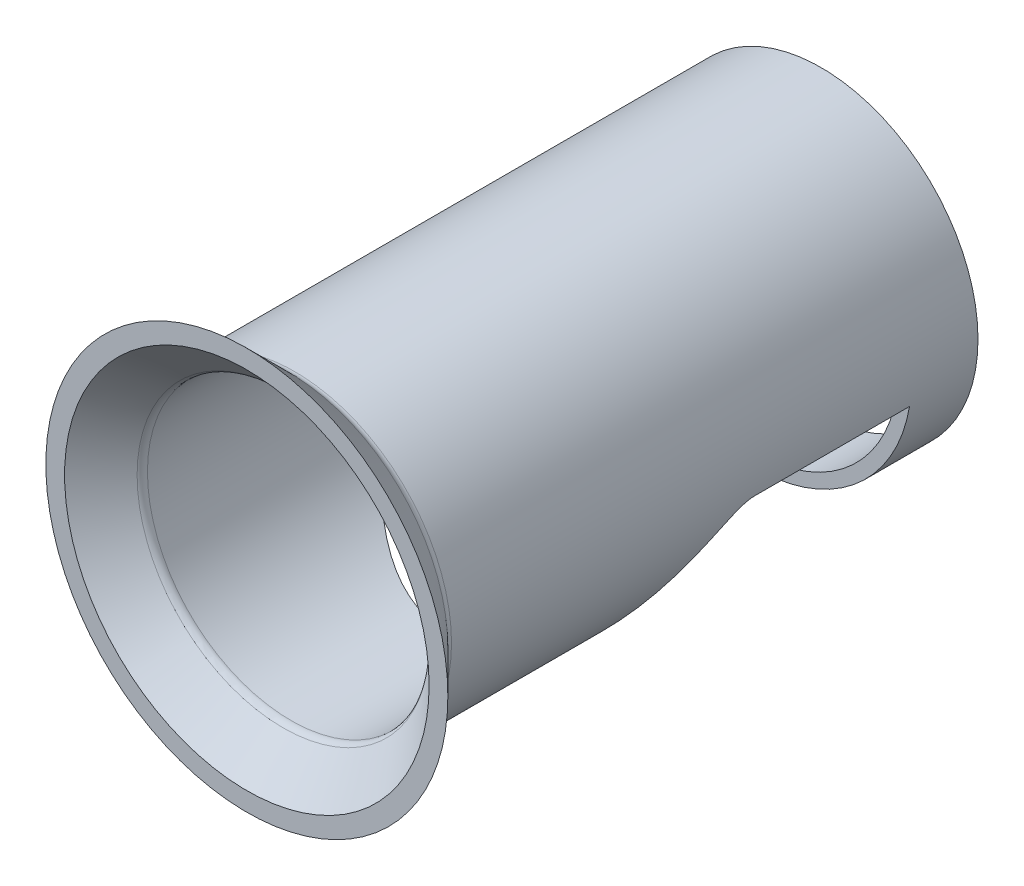
from build123d import *

# Parameters (mm, degrees)
SCHIZZO1_R                   = 17.75
SCHIZZO1_R_2                 = 16.25
ESTRUSIONE_ESTRUSIONE1_DEPTH = 170
TAGLIO_ESTRUSIONE1_DEPTH     = 170
TAGLIO_ESTRUSIONE2_START     = -60
SCHIZZO4_R                   = 41.734641341
TAGLIO_ESTRUSIONE2_DEPTH     = 112.843315381
SCHIZZO5_R                   = 17.75
SCHIZZO6_R                   = 22.75
RACCORDO1_R                  = 1


with BuildPart() as part:
    # Schizzo1 → Estrusione-Estrusione1 (new body)
    with BuildSketch(Plane.XY):
        Circle(SCHIZZO1_R)
        Circle(SCHIZZO1_R_2, mode=Mode.SUBTRACT)
    extrude(amount=ESTRUSIONE_ESTRUSIONE1_DEPTH)

    # Schizzo2 → Taglio-Estrusione1 (cut)
    with BuildSketch(Plane(origin=(0, 0, 0), x_dir=(1, 0, 0), z_dir=(0, 1, 0))):
        with BuildLine():
            Line((-17.5, -25), (-17.5, -7.5))
            Line((-17.5, -7.5), (17.5, -7.5))
            Line((17.5, -7.5), (17.5, -25))
            ThreePointArc((17.5, -25), (0, -42.5), (-17.5, -25))
        make_face()
    extrude(amount=-TAGLIO_ESTRUSIONE1_DEPTH, mode=Mode.SUBTRACT)

    # Schizzo4 → Taglio-Estrusione2 (cut, through all)
    with BuildSketch(Plane(origin=(0, 0, 0), x_dir=(-1, 0, 0), z_dir=(0, 0, -1)).offset(TAGLIO_ESTRUSIONE2_START)):
        Circle(SCHIZZO4_R)
    extrude(amount=-TAGLIO_ESTRUSIONE2_DEPTH, mode=Mode.SUBTRACT)

    # Schizzo5 → Loft2 section 0
    with BuildSketch(Plane.XY.offset(60)):
        Circle(SCHIZZO5_R)
    # Schizzo6 → Loft2 section 1
    with BuildSketch(Plane.XY.offset(65)):
        Circle(SCHIZZO6_R)
    loft()

    # Schizzo9 → Taglia-Rivoluzione1 (revolve, cut)
    with BuildSketch(Plane(origin=(0, 0, 0), x_dir=(1, 0, 0), z_dir=(0, 1, 0)), mode=Mode.PRIVATE) as taglia_rivoluzione1_sk:
        Polygon((0, -53.809990156), (0, -67.47386211), (23.102541766, -67.47386211), (9.438669813, -53.809990156), align=None)
    revolve(taglia_rivoluzione1_sk.sketch.rotate(Axis((0, 0, 53.809990156), (0, 0, 1)), 180), axis=Axis((0, 0, 53.809990156), (0, 0, 1)), mode=Mode.SUBTRACT)

    # Raccordo1
    # the kernel refuses this fillet: 1 mm, written as the material it adds along each edge
    with BuildSketch(Plane(origin=(13.75, 0, 7.5), x_dir=(0, -1, 0), z_dir=(1, 0, 0))) as raccordo1_piece_1_section:
        with BuildLine():
            CenterArc((RACCORDO1_R, -RACCORDO1_R), RACCORDO1_R, 90, 90)
            Line((0, -RACCORDO1_R), (0, 0))
            Line((0, 0), (RACCORDO1_R, 0))
        make_face()
    raccordo1_piece_1 = extrude(amount=3.75, mode=Mode.PRIVATE)
    raccordo1_piece_1 = raccordo1_piece_1 - Plane(origin=(0, 0, 7.5), x_dir=(1, 0, 0), z_dir=(0, 0, -1)) * Cylinder(16.25, 12, mode=Mode.PRIVATE)
    add(raccordo1_piece_1)
    with BuildSketch(Plane(origin=(-17.5, 0, 7.5), x_dir=(0, -1, 0), z_dir=(1, 0, 0))) as raccordo1_piece_2_section:
        with BuildLine():
            CenterArc((RACCORDO1_R, -RACCORDO1_R), RACCORDO1_R, 90, 90)
            Line((0, -RACCORDO1_R), (0, 0))
            Line((0, 0), (RACCORDO1_R, 0))
        make_face()
    raccordo1_piece_2 = extrude(amount=3.75, mode=Mode.PRIVATE)
    raccordo1_piece_2 = raccordo1_piece_2 - Plane(origin=(0, 0, 7.5), x_dir=(1, 0, 0), z_dir=(0, 0, -1)) * Cylinder(16.25, 12, mode=Mode.PRIVATE)
    add(raccordo1_piece_2)
    with BuildSketch(Plane(origin=(0, 0, 60), x_dir=(1, 0, 0), z_dir=(0, 1, 0))) as raccordo1_piece_3:
        with BuildLine():
            CenterArc((17.75 + RACCORDO1_R, RACCORDO1_R * 0.414213562373), RACCORDO1_R, 180, 45)
            Line((17.75 + RACCORDO1_R * 0.292893218813, -RACCORDO1_R * 0.292893218813), (17.75, 0))
            Line((17.75, 0), (17.75, RACCORDO1_R * 0.414213562373))
        make_face()
    revolve(axis=Axis((0, 0, 60), (0, 0, -1)))
    # the kernel refuses this fillet: 1 mm, written as the material it takes off along each edge
    with BuildSketch(Plane(origin=(0, 0, 60), x_dir=(-1, 0, 0), z_dir=(0, -1, 0))) as raccordo1_2_piece_1:
        with BuildLine():
            CenterArc((17.231963548, -0.18907033), RACCORDO1_R, 169.101465323, 55.898534677)
            Line((16.524856767, -0.896177111), (15.628679656, 0))
            Line((15.628679656, 0), (16.25, 0))
        make_face()
    revolve(axis=Axis((0, 0, 60), (0, 0, -1)), mode=Mode.SUBTRACT)


solid = part.part
